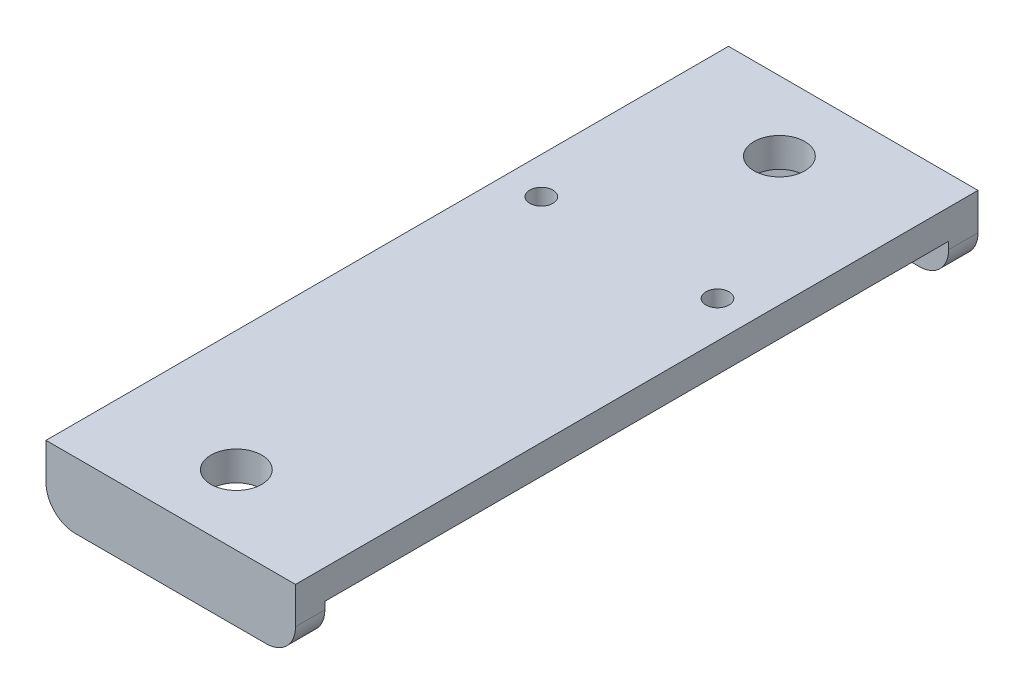
from build123d import *

# Parameters (mm, degrees)
EXTRUDE_THIN1_DEPTH = 21.59
CUT_EXTRUDE1_REACH  = 39.022
SKETCH2_R           = 1
FILLET1_R           = 2.54
CUT_EXTRUDE2_REACH  = 39.022
SKETCH3_R           = 2.2


with BuildPart() as part:
    # Sketch1 → Extrude-Thin1 (new body)
    with BuildSketch(Plane(origin=(0, 0, 0), x_dir=(0, 0, -1), z_dir=(1, 0, 0))):
        Polygon((-26.9875, -3.175), (-26.9875, 0), (26.9875, 0), (26.9875, -3.175), (29.5275, -3.175), (29.5275, 2.54), (-29.5275, 2.54), (-29.5275, -3.175), align=None)
    extrude(amount=EXTRUDE_THIN1_DEPTH)

    # Sketch2 → Cut-Extrude1 (cut, up to next)
    with BuildSketch(Plane(origin=(0, 2.54, 0), x_dir=(1, 0, 0), z_dir=(0, 1, 0)), mode=Mode.PRIVATE) as cut_extrude1_sk1:
        with Locations((3.175, 10.16)):
            Circle(SKETCH2_R)
    cut_extrude1_tool1 = extrude(cut_extrude1_sk1.sketch, amount=-CUT_EXTRUDE1_REACH, mode=Mode.PRIVATE) & part.part
    # Sketch2 → Cut-Extrude1 (cut, up to next)
    with BuildSketch(Plane(origin=(0, 2.54, 0), x_dir=(1, 0, 0), z_dir=(0, 1, 0)), mode=Mode.PRIVATE) as cut_extrude1_sk2:
        with Locations((18.415, 10.16)):
            Circle(SKETCH2_R)
    cut_extrude1_tool2 = extrude(cut_extrude1_sk2.sketch, amount=-CUT_EXTRUDE1_REACH, mode=Mode.PRIVATE) & part.part
    add(cut_extrude1_tool1.solids().sort_by_distance((3.175, 2.54, -10.16))[0], mode=Mode.SUBTRACT)
    add(cut_extrude1_tool2.solids().sort_by_distance((18.415, 2.54, -10.16))[0], mode=Mode.SUBTRACT)

    # Fillet1
    fillet1_edges = [part.edges().sort_by_distance(p)[0] for p in [
        (0, -3.175, 28.2575),
        (21.59, -3.175, 28.2575),
        (0, -3.175, -28.2575),
        (21.59, -3.175, -28.2575),
    ]]
    fillet(fillet1_edges, radius=FILLET1_R)

    # Sketch3 → Cut-Extrude2 (cut, up to next)
    with BuildSketch(Plane(origin=(0, 2.54, 0), x_dir=(1, 0, 0), z_dir=(0, 1, 0)), mode=Mode.PRIVATE) as cut_extrude2_sk1:
        with Locations((10.436798518, -23.495)):
            Circle(SKETCH3_R)
    cut_extrude2_tool1 = extrude(cut_extrude2_sk1.sketch, amount=-CUT_EXTRUDE2_REACH, mode=Mode.PRIVATE) & part.part
    # Sketch3 → Cut-Extrude2 (cut, up to next)
    with BuildSketch(Plane(origin=(0, 2.54, 0), x_dir=(1, 0, 0), z_dir=(0, 1, 0)), mode=Mode.PRIVATE) as cut_extrude2_sk2:
        with Locations((10.436798518, 23.495)):
            Circle(SKETCH3_R)
    cut_extrude2_tool2 = extrude(cut_extrude2_sk2.sketch, amount=-CUT_EXTRUDE2_REACH, mode=Mode.PRIVATE) & part.part
    add(cut_extrude2_tool1.solids().sort_by_distance((10.436799, 2.54, 23.495))[0], mode=Mode.SUBTRACT)
    add(cut_extrude2_tool2.solids().sort_by_distance((10.436799, 2.54, -23.495))[0], mode=Mode.SUBTRACT)


solid = part.part
